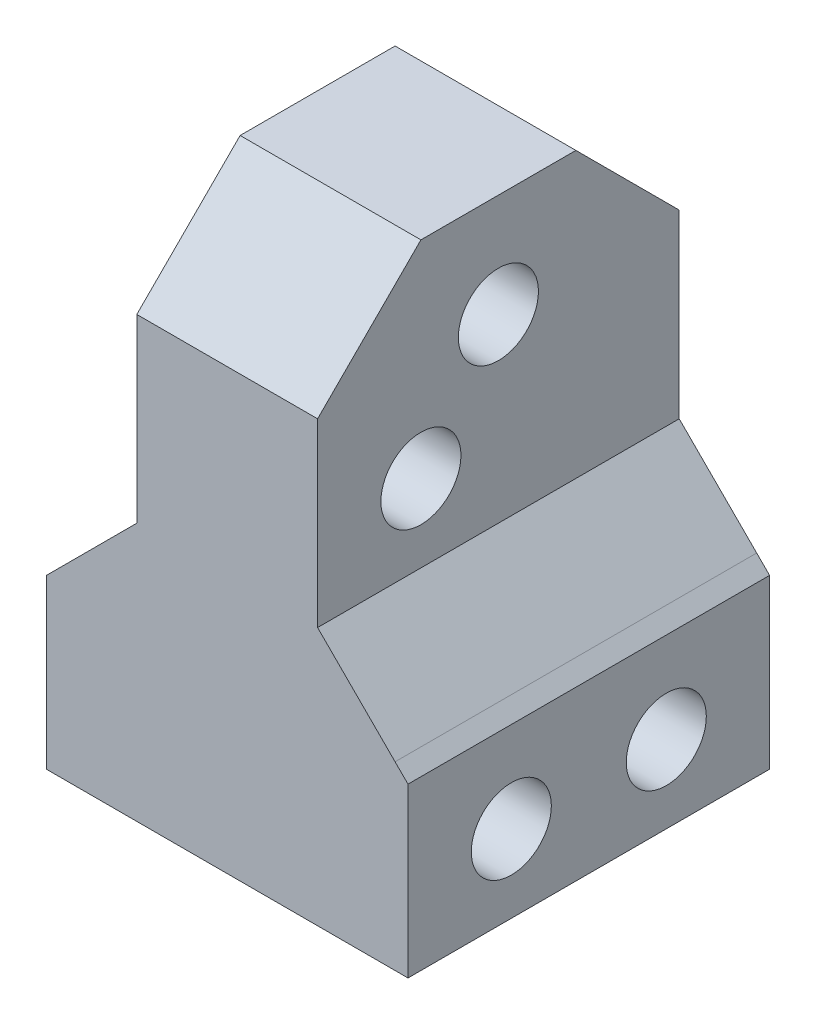
from build123d import *

# Parameters (mm, degrees)
SKETCH1_W               = 14
SKETCH1_H               = 14
BOSS_EXTRUDE1_DEPTH     = 7
SKETCH2_W               = 7
SKETCH2_H               = 14
BOSS_EXTRUDE2_DEPTH     = 14
CHAMFER1_SIZE           = 3
CHAMFER2_SIZE           = 0.5
CHAMFER3_SIZE           = 4
CUT_EXTRUDE1_DEPTH      = 28.335873866
CUT_EXTRUDE1_DEPTH_BACK = 28.335873866
SKETCH3_R               = 1.55
SKETCH5_W               = 6.4
SKETCH5_H               = 13
CUT_EXTRUDE2_DEPTH      = 0.54


with BuildPart() as part:
    # Sketch1 → Boss-Extrude1 (new body)
    with BuildSketch(Plane(origin=(0, 0, 0), x_dir=(1, 0, 0), z_dir=(0, 1, 0))):
        with Locations((7, 7)):
            Rectangle(SKETCH1_W, SKETCH1_H)
    extrude(amount=BOSS_EXTRUDE1_DEPTH)

    # Sketch2 → Boss-Extrude2 (add)
    with BuildSketch(Plane(origin=(0, 7, 0), x_dir=(1, 0, 0), z_dir=(0, 1, 0))):
        with Locations((7, 7)):
            Rectangle(SKETCH2_W, SKETCH2_H)
    extrude(amount=BOSS_EXTRUDE2_DEPTH)

    # Chamfer1
    chamfer1_edges = [part.edges().sort_by_distance(p)[0] for p in [
        (3.5, 7, -7),
        (10.5, 7, -7),
    ]]
    chamfer(chamfer1_edges, length=CHAMFER1_SIZE)

    # Chamfer2
    chamfer2_edges = [part.edges().sort_by_distance(p)[0] for p in [
        (0, 7, -7),
        (14, 7, -7),
    ]]
    chamfer(chamfer2_edges, length=CHAMFER2_SIZE - 0.0001)  # a hair under: the kernel refuses the full size

    # Chamfer3
    chamfer3_edges = [part.edges().sort_by_distance(p)[0] for p in [
        (7, 21, 0),
        (7, 21, -14),
    ]]
    chamfer(chamfer3_edges, length=CHAMFER3_SIZE)

    # Sketch3 → Cut-Extrude1 (cut, two sides: drawn at the far end of the back side and taken through both)
    with BuildSketch(Plane(origin=(10.5, 0, 0), x_dir=(0, 0, -1), z_dir=(1, 0, 0)).offset(-CUT_EXTRUDE1_DEPTH_BACK)):
        with Locations((7, 17)):
            Circle(SKETCH3_R)
        with Locations((4, 13)):
            Circle(SKETCH3_R)
        with Locations((4, 3)):
            Circle(SKETCH3_R)
        with Locations((10, 3)):
            Circle(SKETCH3_R)
    extrude(amount=CUT_EXTRUDE1_DEPTH + CUT_EXTRUDE1_DEPTH_BACK, mode=Mode.SUBTRACT)

    # Sketch5 → Cut-Extrude2 (cut)
    with BuildSketch(Plane.XZ):
        with Locations((7, -7)):
            Rectangle(SKETCH5_W, SKETCH5_H)
    extrude(amount=-CUT_EXTRUDE2_DEPTH, mode=Mode.SUBTRACT)


solid = part.part
